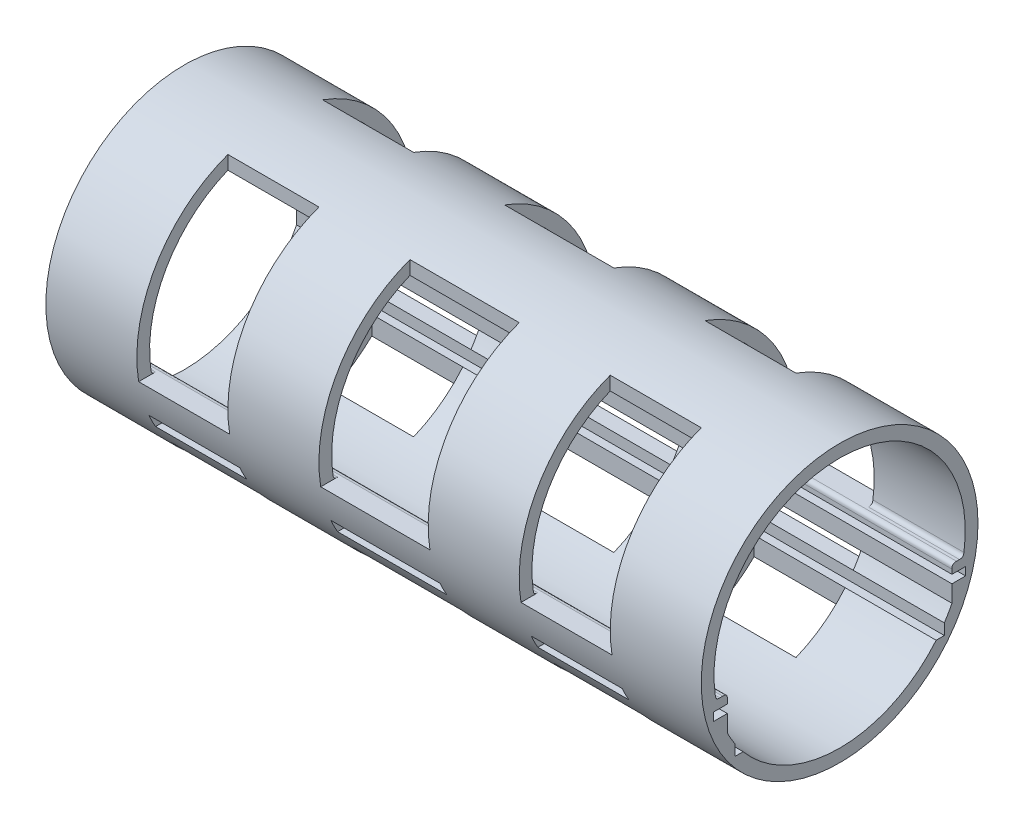
from build123d import *

# Parameters (mm, degrees)
SKETCH1_R               = 76
SKETCH1_R_2             = 69
BOSS_EXTRUDE3_DEPTH     = 360
CUT_EXTRUDE1_DEPTH      = 125
CUT_EXTRUDE1_DEPTH_BACK = 135
SKETCH2_W               = 50
SKETCH2_H               = 50
SKETCH2_W_2             = 60
CUT_EXTRUDE3_DEPTH      = 196
CUT_EXTRUDE3_DEPTH_BACK = 244
SKETCH3_W               = 60
SKETCH3_H               = 50
SKETCH3_W_2             = 50
CUT_EXTRUDE4_DEPTH      = 404
BOSS_EXTRUDE5_DEPTH     = 360


with BuildPart() as part:
    # Sketch1 → Boss-Extrude3 (new body)
    with BuildSketch(Plane(origin=(0, 0, 0), x_dir=(0, 0, -1), z_dir=(1, 0, 0))):
        with Locations(Location((0, 0, 0), (0, 0, 180))):
            Circle(SKETCH1_R)
        with Locations(Location((0, 0, 0), (0, 0, 180))):
            Circle(SKETCH1_R_2, mode=Mode.SUBTRACT)
    extrude(amount=BOSS_EXTRUDE3_DEPTH)

    # Sketch2 → Cut-Extrude1 (cut, two sides: drawn at the far end of the back side and taken through both)
    with BuildSketch(Plane(origin=(0, 0, 0), x_dir=(1, 0, 0), z_dir=(0, 1, 0)).offset(-CUT_EXTRUDE1_DEPTH_BACK)):
        with Locations((75, 51)):
            Rectangle(SKETCH2_W, SKETCH2_H)
        with Locations((285, 51)):
            Rectangle(SKETCH2_W, SKETCH2_H)
        with Locations((180, 51)):
            Rectangle(SKETCH2_W_2, SKETCH2_H)
    extrude(amount=CUT_EXTRUDE1_DEPTH + CUT_EXTRUDE1_DEPTH_BACK, mode=Mode.SUBTRACT)

    # Sketch3 → Cut-Extrude3 (cut, two sides: drawn at the far end of the back side and taken through both)
    with BuildSketch(Plane(origin=(0, 0, 0), x_dir=(1, 0, 0), z_dir=(0, 1, 0)).offset(-CUT_EXTRUDE3_DEPTH_BACK)):
        with Locations((180, -51)):
            Rectangle(SKETCH3_W, SKETCH3_H)
        with Locations((75, -51)):
            Rectangle(SKETCH3_W_2, SKETCH3_H)
        with Locations((285, -51)):
            Rectangle(SKETCH3_W_2, SKETCH3_H)
    extrude(amount=CUT_EXTRUDE3_DEPTH + CUT_EXTRUDE3_DEPTH_BACK, mode=Mode.SUBTRACT)

    # Sketch4 → Cut-Extrude4 (cut)
    with BuildSketch(Plane.ZY):
        with BuildLine():
            Line((-69.189206, -21.658804), (-65.512565, -21.658804))
            ThreePointArc((-65.512565, -21.658804), (-66.210745, -19.420021), (-66.832443, -17.158804))
            Line((-66.832443, -17.158804), (-69.189206, -17.158804))
            Line((-69.189206, -17.158804), (-69.189206, -21.658804))
        make_face()
        with BuildLine():
            Line((-57.5, -38.141185), (-57.5, -44.158804))
            Line((-57.5, -44.158804), (-53.018865, -44.158804))
            ThreePointArc((-53.018865, -44.158804), (-55.341285, -41.210948), (-57.5, -38.141185))
        make_face()
        with BuildLine():
            ThreePointArc((57.5, -38.141185), (55.341285, -41.210948), (53.018865, -44.158804))
            Line((53.018865, -44.158804), (57.5, -44.158804))
            Line((57.5, -44.158804), (57.5, -38.141185))
        make_face()
        with BuildLine():
            ThreePointArc((66.832443, -17.158804), (66.210745, -19.420021), (65.512565, -21.658804))
            Line((65.512565, -21.658804), (69.189206, -21.658804))
            Line((69.189206, -21.658804), (69.189206, -17.158804))
            Line((69.189206, -17.158804), (66.832443, -17.158804))
        make_face()
    extrude(amount=-CUT_EXTRUDE4_DEPTH, mode=Mode.SUBTRACT)

    # Sketch5 → Boss-Extrude5 (add)
    with BuildSketch(Plane.ZY):
        with BuildLine():
            Line((-65.512565, -21.658804), (-69.189206, -21.658804))
            Line((-69.189206, -21.658804), (-69.189206, -17.158804))
            Line((-69.189206, -17.158804), (-61.689206, -17.158804))
            Line((-61.689206, -17.158804), (-61.689206, -12.158804))
            Line((-61.689206, -12.158804), (-67.920273, -12.158804))
            Line((-67.920273, -12.158804), (-75.021087, -12.158804))
            ThreePointArc((-75.021087, -12.158804), (-72.831657, -21.715195), (-69.430239, -30.910223))
            Line((-69.430239, -30.910223), (-61.689206, -30.910223))
            Line((-61.689206, -30.910223), (-61.689206, -21.658804))
            Line((-61.689206, -21.658804), (-65.512565, -21.658804))
        make_face()
        with BuildLine():
            Line((61.689206, -30.910223), (69.430239, -30.910223))
            ThreePointArc((69.430239, -30.910223), (72.831657, -21.715195), (75.021087, -12.158804))
            Line((75.021087, -12.158804), (67.920273, -12.158804))
            Line((67.920273, -12.158804), (61.689206, -12.158804))
            Line((61.689206, -12.158804), (61.689206, -17.158804))
            Line((61.689206, -17.158804), (69.189206, -17.158804))
            Line((69.189206, -17.158804), (69.189206, -21.658804))
            Line((69.189206, -21.658804), (65.512565, -21.658804))
            Line((65.512565, -21.658804), (61.689206, -21.658804))
            Line((61.689206, -21.658804), (61.689206, -30.910223))
        make_face()
        with BuildLine():
            Line((-57.5, -38.141185), (-65.736215, -38.141185))
            ThreePointArc((-65.736215, -38.141185), (-59.934976, -46.731131), (-53.018865, -54.451814))
            Line((-53.018865, -54.451814), (-53.018865, -44.158804))
            Line((-53.018865, -44.158804), (-57.5, -44.158804))
            Line((-57.5, -44.158804), (-57.5, -38.141185))
        make_face()
        with BuildLine():
            Line((57.5, -38.141185), (57.5, -44.158804))
            Line((57.5, -44.158804), (53.018865, -44.158804))
            Line((53.018865, -44.158804), (53.018865, -49.158804))
            Line((53.018865, -49.158804), (57.960434, -49.158804))
            ThreePointArc((57.960434, -49.158804), (62.093174, -43.822799), (65.736215, -38.141185))
            Line((65.736215, -38.141185), (57.5, -38.141185))
        make_face()
    extrude(amount=-BOSS_EXTRUDE5_DEPTH)

    # Fillet1
    # a fillet whose section is not a circle: 2.5 mm, written as the material it adds along each edge (its section moved 0.00015 mm through the faces so that the kernel can cut it)
    with BuildSketch(Plane(origin=(50, -12.158804, 67.920273), x_dir=(0, 0.9869840744393849, 0.16081802387490868), z_dir=(-1, 0, 0)), Plane(origin=(150, -12.158804, 67.920273), x_dir=(0, 0.9869840744393849, 0.16081802387490868), z_dir=(-1, 0, 0)), Plane(origin=(260, -12.158804, 67.920273), x_dir=(0, 0.9869840744393849, 0.16081802387490868), z_dir=(-1, 0, 0)), Plane(origin=(360, -12.158804, 67.920273), x_dir=(0, 0.9869840744393849, 0.16081802387490868), z_dir=(-1, 0, 0))) as fillet1_piece_1:
        with BuildLine():
            add(Edge.make_bspline([(2.165045, 0), (1.793757, -0.005851), (1.42247, -0.011703), (0.597186, 0.116141), (0.048854, 0.574965), (-0.222526, 1.364769), (-0.282243, 1.73127), (-0.34196, 2.09777)], knots=[0, 0, 0, 0, 0, 0, 0.5, 0.5, 1, 1, 1, 1, 1, 1], degree=5))
            Line((-0.34196, 2.09777), (-0.391309, 2.089729))
            ThreePointArc((-0.391309, 2.089729), (-0.220255, 1.040856), (-0.049349, -0.008041))
            Line((-0.049349, -0.008041), (-0.000781, -0.049994))
            ThreePointArc((-0.000781, -0.049994), (1.082527, -0.058417), (2.165833, -0.049994))
            Line((2.165833, -0.049994), (2.165045, 0))
        make_face()
    extrude(amount=50)
    with BuildSketch(Plane(origin=(360, -12.158804, -67.920273), x_dir=(0, 0.9869840744393849, -0.16081802387490907), z_dir=(-1, 0, 0)), Plane(origin=(260, -12.158804, -67.920273), x_dir=(0, 0.9869840744393849, -0.16081802387490907), z_dir=(-1, 0, 0)), Plane(origin=(150, -12.158804, -67.920273), x_dir=(0, 0.9869840744393849, -0.16081802387490907), z_dir=(-1, 0, 0)), Plane(origin=(50, -12.158804, -67.920273), x_dir=(0, 0.9869840744393849, -0.16081802387490907), z_dir=(-1, 0, 0))) as fillet1_piece_2:
        with BuildLine():
            add(Edge.make_bspline([(2.165045, 0), (1.793757, 0.005851), (1.42247, 0.011703), (0.597186, -0.116141), (0.048854, -0.574965), (-0.222526, -1.364769), (-0.282243, -1.73127), (-0.34196, -2.09777)], knots=[0, 0, 0, 0, 0, 0, 0.5, 0.5, 1, 1, 1, 1, 1, 1], degree=5))
            Line((-0.34196, -2.09777), (-0.391309, -2.089729))
            ThreePointArc((-0.391309, -2.089729), (-0.220255, -1.040856), (-0.049349, 0.008041))
            Line((-0.049349, 0.008041), (-0.000781, 0.049994))
            ThreePointArc((-0.000781, 0.049994), (1.082527, 0.058417), (2.165833, 0.049994))
            Line((2.165833, 0.049994), (2.165045, 0))
        make_face()
    extrude(amount=50)
    # a fillet whose section is not a circle: 2.5 mm, written as the material it takes off along each edge (its section moved 0.00015 mm through the faces so that the kernel can cut it)
    with BuildSketch(Plane(origin=(-6.25, -12.158804, -61.689206), x_dir=(0, 5.9999999891860166e-05, -0.9999999982000001), z_dir=(1, 0, 0))) as fillet1_2_piece_1:
        with BuildLine():
            add(Edge.make_bspline([(2.5, 0), (2.07948, 2.5e-05), (1.658959, 5e-05), (0.732116, -0.179134), (0.179047, -0.732138), (-0.00025, -1.658959), (-0.000275, -2.07948), (-0.0003, -2.5)], knots=[0, 0, 0, 0, 0, 0, 0.5, 0.5, 1, 1, 1, 1, 1, 1], degree=5))
            Line((-0.0003, -2.5), (-0.0503, -2.499997))
            ThreePointArc((-0.0503, -2.499997), (-0.050075, -1.249997), (-0.05, 3e-06))
            Line((-0.05, 3e-06), (3e-06, 0.05))
            ThreePointArc((3e-06, 0.05), (1.250003, 0.049925), (2.500003, 0.05))
            Line((2.500003, 0.05), (2.5, 0))
        make_face()
    extrude(amount=372.5, mode=Mode.SUBTRACT)
    with BuildSketch(Plane(origin=(-6.25, -12.158804, 61.689206), x_dir=(0, 5.9999999891860166e-05, 0.9999999982000001), z_dir=(1, 0, 0))) as fillet1_2_piece_2:
        with BuildLine():
            add(Edge.make_bspline([(2.5, 0), (2.07948, -2.5e-05), (1.658959, -5e-05), (0.732116, 0.179134), (0.179047, 0.732138), (-0.00025, 1.658959), (-0.000275, 2.07948), (-0.0003, 2.5)], knots=[0, 0, 0, 0, 0, 0, 0.5, 0.5, 1, 1, 1, 1, 1, 1], degree=5))
            Line((-0.0003, 2.5), (-0.0503, 2.499997))
            ThreePointArc((-0.0503, 2.499997), (-0.050075, 1.249997), (-0.05, -3e-06))
            Line((-0.05, -3e-06), (3e-06, -0.05))
            ThreePointArc((3e-06, -0.05), (1.250003, -0.049925), (2.500003, -0.05))
            Line((2.500003, -0.05), (2.5, 0))
        make_face()
    extrude(amount=372.5, mode=Mode.SUBTRACT)


solid = part.part
